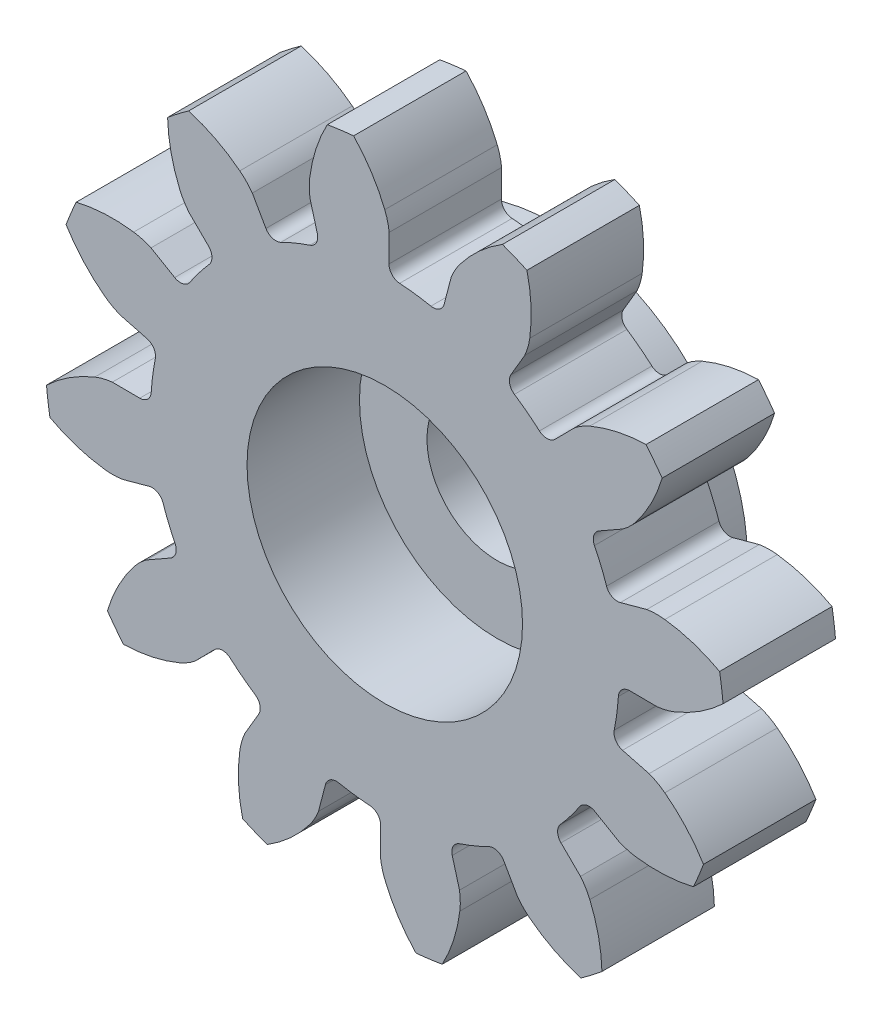
from build123d import *

# Parameters (mm, degrees)
SKETCH1_R           = 2.45
BOSS_EXTRUDE1_DEPTH = 2
SKETCH2_R           = 3.45
SKETCH2_R_2         = 1.25
BOSS_EXTRUDE2_DEPTH = 1


with BuildPart() as part:
    # Sketch1 → Boss-Extrude1 (new body)
    with BuildSketch(Plane.XY):
        with BuildLine():
            Line((-1.328942795, 4.660504482), (-1.19987949, 4.189818801))
            ThreePointArc((-1.19987949, 4.189818801), (-1.216390887, 4.041213658), (-1.330404162, 3.944481617))
            ThreePointArc((-1.330404162, 3.944481617), (-1.593034897, 3.845926453), (-1.848431895, 3.729907504))
            ThreePointArc((-1.848431895, 3.729907504), (-1.997451337, 3.717687826), (-2.114206362, 3.81109221))
            Line((-2.114206362, 3.81109221), (-2.35576986, 4.235178785))
            ThreePointArc((-2.35576986, 4.235178785), (-2.458763141, 4.358582017), (-2.578277712, 4.466063368))
            ThreePointArc((-2.578277712, 4.466063368), (-3.011522784, 4.742385054), (-3.488492609, 4.933578024))
            ThreePointArc((-3.488492609, 4.933578024), (-3.678338502, 4.793704066), (-3.862582103, 4.646529059))
            ThreePointArc((-3.862582103, 4.646529059), (-3.80135275, 4.136327205), (-3.646578574, 3.646327286))
            ThreePointArc((-3.646578574, 3.646327286), (-3.573692208, 3.503066854), (-3.481150462, 3.371643878))
            Line((-3.481150462, 3.371643878), (-3.13403552, 3.028549774))
            ThreePointArc((-3.13403552, 3.028549774), (-3.074032238, 2.891598246), (-3.12440461, 2.750819204))
            ThreePointArc((-3.12440461, 2.750819204), (-3.302571916, 2.534152561), (-3.46574273, 2.305978705))
            ThreePointArc((-3.46574273, 2.305978705), (-3.588687514, 2.220886432), (-3.736502523, 2.243399489))
            Line((-3.736502523, 2.243399489), (-4.157745937, 2.489887487))
            ThreePointArc((-4.157745937, 2.489887487), (-4.308642351, 2.545261181), (-4.465885681, 2.578585476))
            ThreePointArc((-4.465885681, 2.578585476), (-4.979247762, 2.601264539), (-5.487912233, 2.528357596))
            ThreePointArc((-5.487912233, 2.528357596), (-5.582386619, 2.312300248), (-5.668358756, 2.092721153))
            ThreePointArc((-5.668358756, 2.092721153), (-5.360231653, 1.681488063), (-4.981193325, 1.334522773))
            ThreePointArc((-4.981193325, 1.334522773), (-4.846441665, 1.246898783), (-4.700586673, 1.17935402))
            Line((-4.700586673, 1.17935402), (-4.228429264, 1.05578328))
            ThreePointArc((-4.228429264, 1.05578328), (-4.107989133, 0.96718142), (-4.081223366, 0.820077007))
            ThreePointArc((-4.081223366, 0.820077007), (-4.127187457, 0.543354537), (-4.1544106, 0.264164774))
            ThreePointArc((-4.1544106, 0.264164774), (-4.218337769, 0.129000312), (-4.357605851, 0.074589687))
            Line((-4.357605851, 0.074589687), (-4.845657348, 0.077432848))
            ThreePointArc((-4.845657348, 0.077432848), (-5.004024322, 0.049939666), (-5.156863188, 0.000177687))
            ThreePointArc((-5.156863188, 0.000177687), (-5.612787323, -0.236862708), (-6.016850205, -0.554334209))
            ThreePointArc((-6.016850205, -0.554334209), (-5.99063875, -0.788682554), (-5.955303257, -1.021829696))
            ThreePointArc((-5.955303257, -1.021829696), (-5.482840813, -1.223904448), (-4.981101347, -1.334866039))
            ThreePointArc((-4.981101347, -1.334866039), (-4.820590991, -1.34337481), (-4.660504482, -1.328942795))
            Line((-4.660504482, -1.328942795), (-4.189818801, -1.19987949))
            ThreePointArc((-4.189818801, -1.19987949), (-4.041213658, -1.216390887), (-3.944481617, -1.330404162))
            ThreePointArc((-3.944481617, -1.330404162), (-3.845926453, -1.593034897), (-3.729907504, -1.848431895))
            ThreePointArc((-3.729907504, -1.848431895), (-3.717687826, -1.997451337), (-3.81109221, -2.114206362))
            Line((-3.81109221, -2.114206362), (-4.235178785, -2.35576986))
            ThreePointArc((-4.235178785, -2.35576986), (-4.358582017, -2.458763141), (-4.466063368, -2.578277712))
            ThreePointArc((-4.466063368, -2.578277712), (-4.742385054, -3.011522784), (-4.933578024, -3.488492609))
            ThreePointArc((-4.933578024, -3.488492609), (-4.793704066, -3.678338502), (-4.646529059, -3.862582103))
            ThreePointArc((-4.646529059, -3.862582103), (-4.136327205, -3.80135275), (-3.646327286, -3.646578574))
            ThreePointArc((-3.646327286, -3.646578574), (-3.503066854, -3.573692208), (-3.371643878, -3.481150462))
            Line((-3.371643878, -3.481150462), (-3.028549774, -3.13403552))
            ThreePointArc((-3.028549774, -3.13403552), (-2.891598246, -3.074032238), (-2.750819204, -3.12440461))
            ThreePointArc((-2.750819204, -3.12440461), (-2.534152561, -3.302571916), (-2.305978705, -3.46574273))
            ThreePointArc((-2.305978705, -3.46574273), (-2.220886432, -3.588687514), (-2.243399489, -3.736502523))
            Line((-2.243399489, -3.736502523), (-2.489887487, -4.157745937))
            ThreePointArc((-2.489887487, -4.157745937), (-2.545261181, -4.308642351), (-2.578585476, -4.465885681))
            ThreePointArc((-2.578585476, -4.465885681), (-2.601264539, -4.979247762), (-2.528357596, -5.487912233))
            ThreePointArc((-2.528357596, -5.487912233), (-2.312300248, -5.582386619), (-2.092721153, -5.668358756))
            ThreePointArc((-2.092721153, -5.668358756), (-1.681488063, -5.360231653), (-1.334522773, -4.981193325))
            ThreePointArc((-1.334522773, -4.981193325), (-1.246898783, -4.846441665), (-1.17935402, -4.700586673))
            Line((-1.17935402, -4.700586673), (-1.05578328, -4.228429264))
            ThreePointArc((-1.05578328, -4.228429264), (-0.96718142, -4.107989133), (-0.820077007, -4.081223366))
            ThreePointArc((-0.820077007, -4.081223366), (-0.543354537, -4.127187457), (-0.264164774, -4.1544106))
            ThreePointArc((-0.264164774, -4.1544106), (-0.129000312, -4.218337769), (-0.074589687, -4.357605851))
            Line((-0.074589687, -4.357605851), (-0.077432848, -4.845657348))
            ThreePointArc((-0.077432848, -4.845657348), (-0.049939666, -5.004024322), (-0.000177687, -5.156863188))
            ThreePointArc((-0.000177687, -5.156863188), (0.236862708, -5.612787323), (0.554334209, -6.016850205))
            ThreePointArc((0.554334209, -6.016850205), (0.788682554, -5.99063875), (1.021829696, -5.955303257))
            ThreePointArc((1.021829696, -5.955303257), (1.223904448, -5.482840813), (1.334866039, -4.981101347))
            ThreePointArc((1.334866039, -4.981101347), (1.34337481, -4.820590991), (1.328942795, -4.660504482))
            Line((1.328942795, -4.660504482), (1.19987949, -4.189818801))
            ThreePointArc((1.19987949, -4.189818801), (1.216390887, -4.041213658), (1.330404162, -3.944481617))
            ThreePointArc((1.330404162, -3.944481617), (1.593034897, -3.845926453), (1.848431895, -3.729907504))
            ThreePointArc((1.848431895, -3.729907504), (1.997451337, -3.717687826), (2.114206362, -3.81109221))
            Line((2.114206362, -3.81109221), (2.35576986, -4.235178785))
            ThreePointArc((2.35576986, -4.235178785), (2.458763141, -4.358582017), (2.578277712, -4.466063368))
            ThreePointArc((2.578277712, -4.466063368), (3.011522784, -4.742385054), (3.488492609, -4.933578024))
            ThreePointArc((3.488492609, -4.933578024), (3.678338502, -4.793704066), (3.862582103, -4.646529059))
            ThreePointArc((3.862582103, -4.646529059), (3.80135275, -4.136327205), (3.646578574, -3.646327286))
            ThreePointArc((3.646578574, -3.646327286), (3.573692208, -3.503066854), (3.481150462, -3.371643878))
            Line((3.481150462, -3.371643878), (3.13403552, -3.028549774))
            ThreePointArc((3.13403552, -3.028549774), (3.074032238, -2.891598246), (3.12440461, -2.750819204))
            ThreePointArc((3.12440461, -2.750819204), (3.302571916, -2.534152561), (3.46574273, -2.305978705))
            ThreePointArc((3.46574273, -2.305978705), (3.588687514, -2.220886432), (3.736502523, -2.243399489))
            Line((3.736502523, -2.243399489), (4.157745937, -2.489887487))
            ThreePointArc((4.157745937, -2.489887487), (4.308642351, -2.545261181), (4.465885681, -2.578585476))
            ThreePointArc((4.465885681, -2.578585476), (4.979247762, -2.601264539), (5.487912233, -2.528357596))
            ThreePointArc((5.487912233, -2.528357596), (5.582386619, -2.312300248), (5.668358756, -2.092721153))
            ThreePointArc((5.668358756, -2.092721153), (5.360231653, -1.681488063), (4.981193325, -1.334522773))
            ThreePointArc((4.981193325, -1.334522773), (4.846441665, -1.246898783), (4.700586673, -1.17935402))
            Line((4.700586673, -1.17935402), (4.228429264, -1.05578328))
            ThreePointArc((4.228429264, -1.05578328), (4.107989133, -0.96718142), (4.081223366, -0.820077007))
            ThreePointArc((4.081223366, -0.820077007), (4.127187457, -0.543354537), (4.1544106, -0.264164774))
            ThreePointArc((4.1544106, -0.264164774), (4.218337769, -0.129000312), (4.357605851, -0.074589687))
            Line((4.357605851, -0.074589687), (4.845657348, -0.077432848))
            ThreePointArc((4.845657348, -0.077432848), (5.004024322, -0.049939666), (5.156863188, -0.000177687))
            ThreePointArc((5.156863188, -0.000177687), (5.612787323, 0.236862708), (6.016850205, 0.554334209))
            ThreePointArc((6.016850205, 0.554334209), (5.99063875, 0.788682554), (5.955303257, 1.021829696))
            ThreePointArc((5.955303257, 1.021829696), (5.482840813, 1.223904448), (4.981101347, 1.334866039))
            ThreePointArc((4.981101347, 1.334866039), (4.820590991, 1.34337481), (4.660504482, 1.328942795))
            Line((4.660504482, 1.328942795), (4.189818801, 1.19987949))
            ThreePointArc((4.189818801, 1.19987949), (4.041213658, 1.216390887), (3.944481617, 1.330404162))
            ThreePointArc((3.944481617, 1.330404162), (3.845926453, 1.593034897), (3.729907504, 1.848431895))
            ThreePointArc((3.729907504, 1.848431895), (3.717687826, 1.997451337), (3.81109221, 2.114206362))
            Line((3.81109221, 2.114206362), (4.235178785, 2.35576986))
            ThreePointArc((4.235178785, 2.35576986), (4.358582017, 2.458763141), (4.466063368, 2.578277712))
            ThreePointArc((4.466063368, 2.578277712), (4.742385054, 3.011522784), (4.933578024, 3.488492609))
            ThreePointArc((4.933578024, 3.488492609), (4.793704066, 3.678338502), (4.646529059, 3.862582103))
            ThreePointArc((4.646529059, 3.862582103), (4.136327205, 3.80135275), (3.646327286, 3.646578574))
            ThreePointArc((3.646327286, 3.646578574), (3.503066854, 3.573692208), (3.371643878, 3.481150462))
            Line((3.371643878, 3.481150462), (3.028549774, 3.13403552))
            ThreePointArc((3.028549774, 3.13403552), (2.891598246, 3.074032238), (2.750819204, 3.12440461))
            ThreePointArc((2.750819204, 3.12440461), (2.534152561, 3.302571916), (2.305978705, 3.46574273))
            ThreePointArc((2.305978705, 3.46574273), (2.220886432, 3.588687514), (2.243399489, 3.736502523))
            Line((2.243399489, 3.736502523), (2.489887487, 4.157745937))
            ThreePointArc((2.489887487, 4.157745937), (2.545261181, 4.308642351), (2.578585476, 4.465885681))
            ThreePointArc((2.578585476, 4.465885681), (2.601264539, 4.979247762), (2.528357596, 5.487912233))
            ThreePointArc((2.528357596, 5.487912233), (2.312300248, 5.582386619), (2.092721153, 5.668358756))
            ThreePointArc((2.092721153, 5.668358756), (1.681488063, 5.360231653), (1.334522773, 4.981193325))
            ThreePointArc((1.334522773, 4.981193325), (1.246898783, 4.846441665), (1.17935402, 4.700586673))
            Line((1.17935402, 4.700586673), (1.05578328, 4.228429264))
            ThreePointArc((1.05578328, 4.228429264), (0.96718142, 4.107989133), (0.820077007, 4.081223366))
            ThreePointArc((0.820077007, 4.081223366), (0.543354537, 4.127187457), (0.264164774, 4.1544106))
            ThreePointArc((0.264164774, 4.1544106), (0.129000312, 4.218337769), (0.074589687, 4.357605851))
            Line((0.074589687, 4.357605851), (0.077432848, 4.845657348))
            ThreePointArc((0.077432848, 4.845657348), (0.049939666, 5.004024322), (0.000177687, 5.156863188))
            ThreePointArc((0.000177687, 5.156863188), (-0.236862708, 5.612787323), (-0.554334209, 6.016850205))
            ThreePointArc((-0.554334209, 6.016850205), (-0.788682554, 5.99063875), (-1.021829696, 5.955303257))
            ThreePointArc((-1.021829696, 5.955303257), (-1.223904448, 5.482840813), (-1.334866039, 4.981101347))
            ThreePointArc((-1.334866039, 4.981101347), (-1.34337481, 4.820590991), (-1.328942795, 4.660504482))
        make_face()
        Circle(SKETCH1_R, mode=Mode.SUBTRACT)
    extrude(amount=BOSS_EXTRUDE1_DEPTH)

    # Sketch2 → Boss-Extrude2 (add)
    with BuildSketch(Plane(origin=(0, 0, 0), x_dir=(-1, 0, 0), z_dir=(0, 0, -1))):
        Circle(SKETCH2_R)
        Circle(SKETCH2_R_2, mode=Mode.SUBTRACT)
    extrude(amount=BOSS_EXTRUDE2_DEPTH)


solid = part.part
